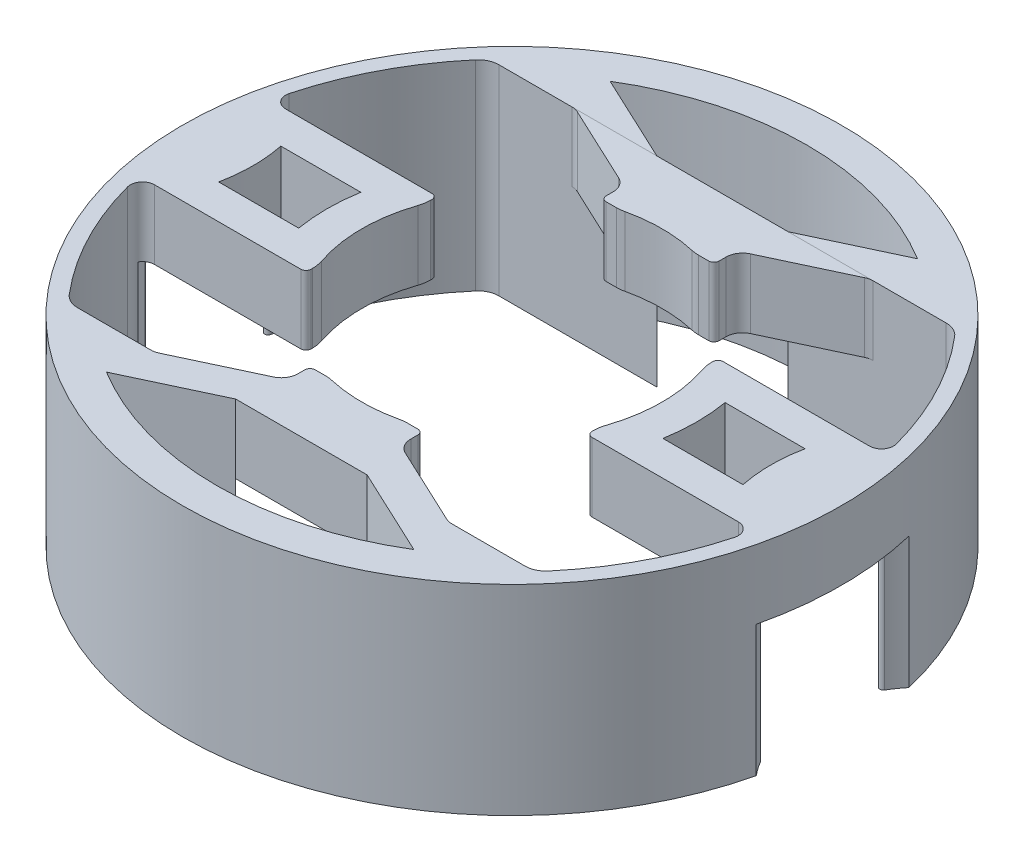
from build123d import *

# Parameters (mm, degrees)
BOSS_EXTRUDE3_DEPTH     = 11.6
BOSS_EXTRUDE4_START     = 7.6
BOSS_EXTRUDE4_DEPTH     = 4
BOSS_EXTRUDE4_2_DEPTH   = 4
BOSS_EXTRUDE5_START     = 7.6
BOSS_EXTRUDE5_DEPTH     = 4
CUT_EXTRUDE2_DEPTH      = 30.063300051
CUT_EXTRUDE2_DEPTH_BACK = 30.063300051
CUT_EXTRUDE3_DEPTH      = 4
BOSS_EXTRUDE7_START     = -4
BOSS_EXTRUDE7_DEPTH     = 4
FILLET2_R               = 0.2


# Read off the part's stored shape, not the designer's step: Boss-Extrude4
with BuildPart() as part:
    # Sketch1 → Boss-Extrude3 (new body)
    with BuildSketch(Plane(origin=(0, 0, 0), x_dir=(1, 0, 0), z_dir=(0, 1, 0))):
        with BuildLine():
            ThreePointArc((-17.58254737, -4.672242255), (-17.599765659, -4.398388566), (-17.51039467, -4.138956227))
            ThreePointArc((-17.51039467, -4.138956227), (-17.599328192, -3.743486895), (-17.679334072, -3.346115252))
            ThreePointArc((-17.679334072, -3.346115252), (-17.701943431, -3.224620591), (-17.72371813, -3.102973568))
            ThreePointArc((-17.72371813, -3.102973568), (-18.10982994, -3.783027476), (-18.569387356, -4.415769626))
            ThreePointArc((-18.569387356, -4.415769626), (0.005448536, -19.086537812), (18.580284429, -4.415769626))
            ThreePointArc((18.580284429, -4.415769626), (18.120727013, -3.783027476), (17.734615203, -3.102973568))
            ThreePointArc((17.734615203, -3.102973568), (17.712840504, -3.224620591), (17.690231145, -3.346115252))
            ThreePointArc((17.690231145, -3.346115252), (17.610225265, -3.743486895), (17.521291743, -4.138956227))
            ThreePointArc((17.521291743, -4.138956227), (17.610662732, -4.398388566), (17.593444443, -4.672242255))
            ThreePointArc((17.593444443, -4.672242255), (16.132822021, -8.427159236), (13.881858032, -11.768712843))
            ThreePointArc((13.881858032, -11.768712843), (13.609040764, -12.005994533), (13.277928812, -12.151241693))
            ThreePointArc((13.277928812, -12.151241693), (0.005448536, -17.992242255), (-13.267031739, -12.151241693))
            ThreePointArc((-13.267031739, -12.151241693), (-13.598143691, -12.005994533), (-13.870960959, -11.768712843))
            ThreePointArc((-13.870960959, -11.768712843), (-16.121924949, -8.427159236), (-17.58254737, -4.672242255))
        make_face()
        with BuildLine():
            ThreePointArc((-17.679334072, 3.361630743), (-17.599328192, 3.759002385), (-17.51039467, 4.154471717))
            ThreePointArc((-17.51039467, 4.154471717), (-17.599765659, 4.413904056), (-17.58254737, 4.687757745))
            ThreePointArc((-17.58254737, 4.687757745), (-16.121924949, 8.442674726), (-13.870960959, 11.784228333))
            ThreePointArc((-13.870960959, 11.784228333), (-13.598143691, 12.021510023), (-13.267031739, 12.166757183))
            ThreePointArc((-13.267031739, 12.166757183), (0.005448536, 18.007757745), (13.277928812, 12.166757183))
            ThreePointArc((13.277928812, 12.166757183), (13.609040764, 12.021510023), (13.881858032, 11.784228333))
            ThreePointArc((13.881858032, 11.784228333), (16.132822021, 8.442674726), (17.593444443, 4.687757745))
            ThreePointArc((17.593444443, 4.687757745), (17.610662732, 4.413904056), (17.521291743, 4.154471717))
            ThreePointArc((17.521291743, 4.154471717), (17.610225265, 3.759002385), (17.690231145, 3.361630743))
            ThreePointArc((17.690231145, 3.361630743), (17.712840504, 3.240136082), (17.734615203, 3.118489059))
            ThreePointArc((17.734615203, 3.118489059), (18.120727013, 3.798542966), (18.580284429, 4.431285117))
            ThreePointArc((18.580284429, 4.431285117), (0.005448536, 19.102053303), (-18.569387356, 4.431285117))
            ThreePointArc((-18.569387356, 4.431285117), (-18.10982994, 3.798542966), (-17.72371813, 3.118489059))
            ThreePointArc((-17.72371813, 3.118489059), (-17.701943431, 3.240136082), (-17.679334072, 3.361630743))
        make_face()
        with BuildLine():
            ThreePointArc((13.277928812, 12.166757183), (0.005448536, 18.007757745), (-13.267031739, 12.166757183))
            ThreePointArc((-13.267031739, 12.166757183), (-13.112877807, 12.197463449), (-12.95603286, 12.207757745))
            Line((-12.95603286, 12.207757745), (-12.242000178, 12.207757745))
            Line((-12.242000178, 12.207757745), (-8.72365395, 12.207757745))
            Line((-8.72365395, 12.207757745), (8.734551023, 12.207757745))
            Line((8.734551023, 12.207757745), (12.25289725, 12.207757745))
            Line((12.25289725, 12.207757745), (12.966929933, 12.207757745))
            ThreePointArc((12.966929933, 12.207757745), (13.123774879, 12.197463449), (13.277928812, 12.166757183))
        make_face()
        with BuildLine():
            ThreePointArc((-12.95603286, -12.192242255), (-13.112877807, -12.181947959), (-13.267031739, -12.151241693))
            ThreePointArc((-13.267031739, -12.151241693), (0.005448536, -17.992242255), (13.277928812, -12.151241693))
            ThreePointArc((13.277928812, -12.151241693), (13.123774879, -12.181947959), (12.966929933, -12.192242255))
            Line((12.966929933, -12.192242255), (12.25289725, -12.192242255))
            Line((12.25289725, -12.192242255), (8.734551023, -12.192242255))
            Line((8.734551023, -12.192242255), (-8.72365395, -12.192242255))
            Line((-8.72365395, -12.192242255), (-12.242000178, -12.192242255))
            Line((-12.242000178, -12.192242255), (-12.95603286, -12.192242255))
        make_face()
    extrude(amount=BOSS_EXTRUDE3_DEPTH)

    # Boss-Extrude4 2 outline → Boss-Extrude4 2 (add)
    with BuildSketch(Plane(origin=(0, 0, 0), x_dir=(1, 0, 0), z_dir=(0, 1, 0)).offset(BOSS_EXTRUDE4_START)):
        with BuildLine():
            Line((3.276809518, -9.128196989), (3.276809518, -8.722832237))
            ThreePointArc((3.276809518, -8.722832237), (3.188941552, -8.510700203), (2.976809518, -8.422832237))
            Line((2.976809518, -8.422832237), (2.391405915, -8.422832237))
            ThreePointArc((2.391405915, -8.422832237), (2.167002233, -8.435461364), (1.945432574, -8.47318925))
            ThreePointArc((1.945432574, -8.47318925), (0.005448536, -8.692242255), (-1.934535501, -8.47318925))
            ThreePointArc((-1.934535501, -8.47318925), (-2.156105161, -8.435461364), (-2.380508843, -8.422832237))
            Line((-2.380508843, -8.422832237), (-2.965912445, -8.422832237))
            ThreePointArc((-2.965912445, -8.422832237), (-3.178044479, -8.510700203), (-3.265912445, -8.722832237))
            Line((-3.265912445, -8.722832237), (-3.265912445, -9.128196989))
            ThreePointArc((-3.265912445, -9.128196989), (-3.414131198, -9.637752512), (-3.812537354, -9.988306595))
            Line((-3.812537354, -9.988306595), (-8.320278858, -12.102351861))
            ThreePointArc((-8.320278858, -12.102351861), (-8.517019159, -12.169497378), (-8.72365395, -12.192242255))
            Line((-8.72365395, -12.192242255), (8.734551023, -12.192242255))
            ThreePointArc((8.734551023, -12.192242255), (8.527916232, -12.169497378), (8.331175931, -12.102351861))
            Line((8.331175931, -12.102351861), (3.823434427, -9.988306595))
            ThreePointArc((3.823434427, -9.988306595), (3.425028271, -9.637752512), (3.276809518, -9.128196989))
        make_face()
    extrude(amount=BOSS_EXTRUDE4_2_DEPTH)

    # Sketch1<9> → Boss-Extrude5 (add)
    with BuildSketch(Plane(origin=(0, 0, 0), x_dir=(1, 0, 0), z_dir=(0, 1, 0)).offset(BOSS_EXTRUDE5_START)):
        with BuildLine():
            Line((-8.131805397, -3.492242255), (-8.131805397, -3.41657908))
            ThreePointArc((-8.131805397, -3.41657908), (-8.15827713, -3.092254889), (-8.236991578, -2.776516122))
            ThreePointArc((-8.236991578, -2.776516122), (-8.694551464, 0.007757745), (-8.236991578, 2.792031613))
            ThreePointArc((-8.236991578, 2.792031613), (-8.15827713, 3.10777038), (-8.131805397, 3.432094571))
            Line((-8.131805397, 3.432094571), (-8.131805397, 3.507757745))
            ThreePointArc((-8.131805397, 3.507757745), (-8.219673362, 3.71988978), (-8.431805397, 3.807757745))
            Line((-8.431805397, 3.807757745), (-16.906085989, 3.807757745))
            ThreePointArc((-16.906085989, 3.807757745), (-17.2544391, 3.900592109), (-17.51039467, 4.154471717))
            ThreePointArc((-17.51039467, 4.154471717), (-17.624667608, 3.638047643), (-17.72371813, 3.118489059))
            ThreePointArc((-17.72371813, 3.118489059), (-16.994551464, 0.007757745), (-17.72371813, -3.102973568))
            ThreePointArc((-17.72371813, -3.102973568), (-17.624667608, -3.622532153), (-17.51039467, -4.138956227))
            ThreePointArc((-17.51039467, -4.138956227), (-17.2544391, -3.885076619), (-16.906085989, -3.792242255))
            Line((-16.906085989, -3.792242255), (-8.431805397, -3.792242255))
            ThreePointArc((-8.431805397, -3.792242255), (-8.219673362, -3.704374289), (-8.131805397, -3.492242255))
        make_face()
        with BuildLine():
            ThreePointArc((16.916983062, -3.792242255), (17.265336173, -3.885076619), (17.521291743, -4.138956227))
            ThreePointArc((17.521291743, -4.138956227), (17.635564681, -3.622532153), (17.734615203, -3.102973568))
            ThreePointArc((17.734615203, -3.102973568), (17.005448536, 0.007757745), (17.734615203, 3.118489059))
            ThreePointArc((17.734615203, 3.118489059), (17.635564681, 3.638047643), (17.521291743, 4.154471717))
            ThreePointArc((17.521291743, 4.154471717), (17.265336173, 3.900592109), (16.916983062, 3.807757745))
            Line((16.916983062, 3.807757745), (8.44270247, 3.807757745))
            ThreePointArc((8.44270247, 3.807757745), (8.230570435, 3.71988978), (8.14270247, 3.507757745))
            Line((8.14270247, 3.507757745), (8.14270247, 3.432094571))
            ThreePointArc((8.14270247, 3.432094571), (8.169174203, 3.10777038), (8.24788865, 2.792031613))
            ThreePointArc((8.24788865, 2.792031613), (8.705448536, 0.007757745), (8.24788865, -2.776516122))
            ThreePointArc((8.24788865, -2.776516122), (8.169174203, -3.092254889), (8.14270247, -3.41657908))
            Line((8.14270247, -3.41657908), (8.14270247, -3.492242255))
            ThreePointArc((8.14270247, -3.492242255), (8.230570435, -3.704374289), (8.44270247, -3.792242255))
            Line((8.44270247, -3.792242255), (16.916983062, -3.792242255))
        make_face()
    extrude(amount=BOSS_EXTRUDE5_DEPTH)

    # Sketch2 → Cut-Extrude2 (cut, two sides: drawn at the far end of the back side and taken through both)
    with BuildSketch(Plane(origin=(0, 11.6, 0), x_dir=(1, 0, 0), z_dir=(0, 1, 0)).offset(-CUT_EXTRUDE2_DEPTH_BACK)):
        with BuildLine():
            Line((-8.900330018, 14.598921131), (-3.801694427, 12.207757745))
            Line((-3.801694427, 12.207757745), (3.812591499, 12.207757745))
            Line((3.812591499, 12.207757745), (8.911227091, 14.598921131))
            ThreePointArc((8.911227091, 14.598921131), (0.005448536, 17.102053303), (-8.900330018, 14.598921131))
        make_face()
        with BuildLine():
            Line((-3.801694427, -12.192242255), (-8.900330018, -14.58340564))
            ThreePointArc((-8.900330018, -14.58340564), (0.005448536, -17.086537812), (8.911227091, -14.58340564))
            Line((8.911227091, -14.58340564), (3.812591499, -12.192242255))
            Line((3.812591499, -12.192242255), (-3.801694427, -12.192242255))
        make_face()
    extrude(amount=CUT_EXTRUDE2_DEPTH + CUT_EXTRUDE2_DEPTH_BACK, mode=Mode.SUBTRACT)

    # Sketch3 → Cut-Extrude3 (cut)
    with BuildSketch(Plane(origin=(0, 11.6, 0), x_dir=(1, 0, 0), z_dir=(0, 1, 0))):
        with BuildLine():
            Line((-15.187285462, 1.807757745), (-10.552960091, 1.807757745))
            ThreePointArc((-10.552960091, 1.807757745), (-10.705448536, 0.007757745), (-10.552960091, -1.792242255))
            Line((-10.552960091, -1.792242255), (-15.187285462, -1.792242255))
            ThreePointArc((-15.187285462, -1.792242255), (-15.005448536, 0.007757745), (-15.187285462, 1.807757745))
        make_face()
        with BuildLine():
            ThreePointArc((10.552960091, -1.792242255), (10.705448536, 0.007757745), (10.552960091, 1.807757745))
            Line((10.552960091, 1.807757745), (15.187285462, 1.807757745))
            ThreePointArc((15.187285462, 1.807757745), (15.005448536, 0.007757745), (15.187285462, -1.792242255))
            Line((15.187285462, -1.792242255), (10.552960091, -1.792242255))
        make_face()
    extrude(amount=-CUT_EXTRUDE3_DEPTH, mode=Mode.SUBTRACT)

    # Sketch6 → Boss-Extrude7 (add)
    with BuildSketch(Plane(origin=(0, 11.6, 0), x_dir=(1, 0, 0), z_dir=(0, 1, 0)).offset(BOSS_EXTRUDE7_START)):
        with BuildLine():
            ThreePointArc((-18.569387356, 4.431285117), (-19.088847021, 0.007757745), (-18.569387356, -4.415769626))
            ThreePointArc((-18.569387356, -4.415769626), (-16.994551464, 0.007757745), (-18.569387356, 4.431285117))
        make_face()
        with BuildLine():
            ThreePointArc((18.580284429, -4.415769626), (19.099744094, 0.007757745), (18.580284429, 4.431285117))
            ThreePointArc((18.580284429, 4.431285117), (17.005448536, 0.007757745), (18.580284429, -4.415769626))
        make_face()
    extrude(amount=BOSS_EXTRUDE7_DEPTH)

    # Fillet2
    fillet2_edges = [part.edges().sort_by_distance(p)[0] for p in [
        (-17.72371813, 3.8, 3.102973568),
        (-17.72371813, 3.8, -3.118489059),
        (17.734615203, 3.8, -3.118489059),
        (17.734615203, 3.8, 3.102973568),
    ]]
    fillet(fillet2_edges, radius=FILLET2_R)


with BuildPart() as body_2:
    # Boss-Extrude4 outline → Boss-Extrude4 (new body)
    with BuildSketch(Plane(origin=(0, 0, 0), x_dir=(1, 0, 0), z_dir=(0, 1, 0)).offset(BOSS_EXTRUDE4_START)):
        with BuildLine():
            ThreePointArc((-3.812537354, 10.003822086), (-3.414131198, 9.653268002), (-3.265912445, 9.143712479))
            Line((-3.265912445, 9.143712479), (-3.265912445, 8.738347728))
            ThreePointArc((-3.265912445, 8.738347728), (-3.17804448, 8.526215693), (-2.965912445, 8.438347728))
            Line((-2.965912445, 8.438347728), (-2.380508843, 8.438347728))
            ThreePointArc((-2.380508843, 8.438347728), (-2.156105161, 8.450976855), (-1.934535501, 8.48870474))
            ThreePointArc((-1.934535501, 8.48870474), (0.005448536, 8.707757745), (1.945432574, 8.48870474))
            ThreePointArc((1.945432574, 8.48870474), (2.167002233, 8.450976855), (2.391405915, 8.438347728))
            Line((2.391405915, 8.438347728), (2.976809518, 8.438347728))
            ThreePointArc((2.976809518, 8.438347728), (3.188941553, 8.526215693), (3.276809518, 8.738347728))
            Line((3.276809518, 8.738347728), (3.276809518, 9.143712479))
            ThreePointArc((3.276809518, 9.143712479), (3.425028271, 9.653268002), (3.823434427, 10.003822086))
            Line((3.823434427, 10.003822086), (8.331175931, 12.117867352))
            ThreePointArc((8.331175931, 12.117867352), (8.527916232, 12.185012868), (8.734551023, 12.207757745))
            Line((8.734551023, 12.207757745), (-8.72365395, 12.207757745))
            ThreePointArc((-8.72365395, 12.207757745), (-8.517019159, 12.185012868), (-8.320278858, 12.117867352))
            Line((-8.320278858, 12.117867352), (-3.812537354, 10.003822086))
        make_face()
    extrude(amount=BOSS_EXTRUDE4_DEPTH)


solid = Compound([part.part, body_2.part])
